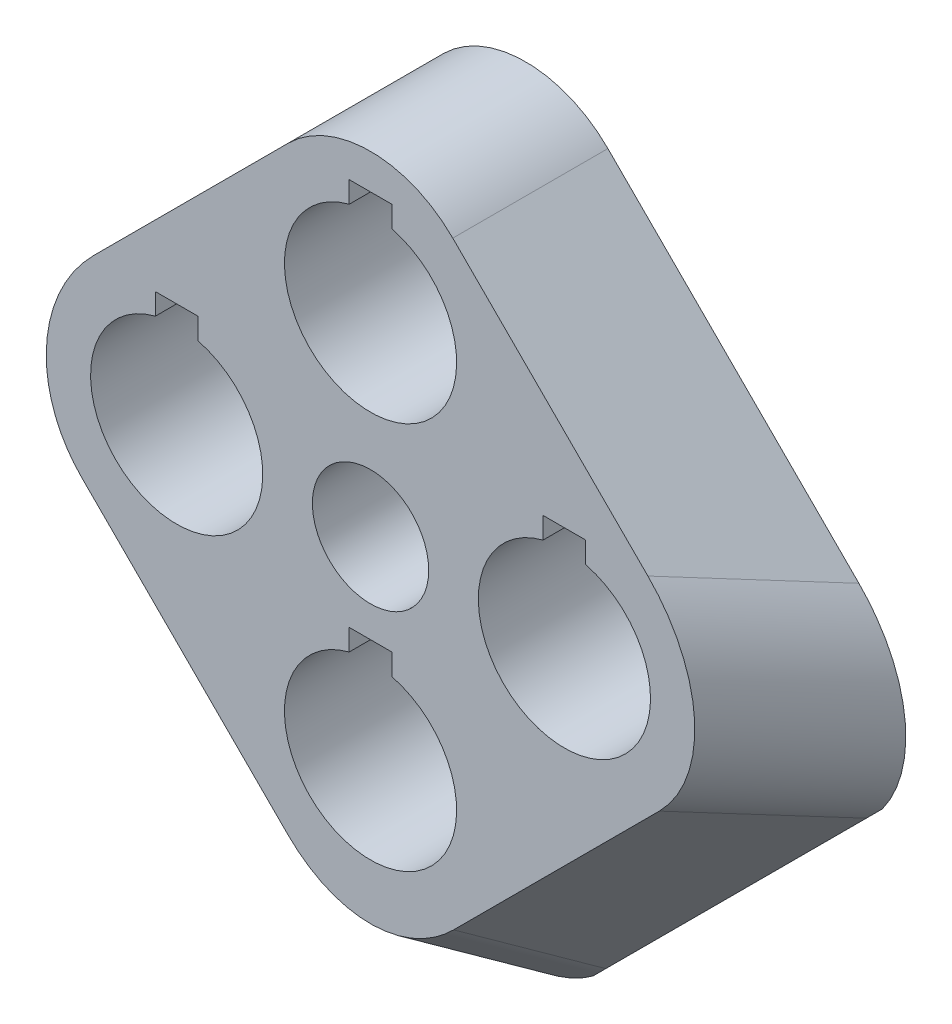
from build123d import *

# Parameters (mm, degrees)
SKETCH1_R           = 7.5
BOSS_EXTRUDE1_DEPTH = 20
FILLET1_R           = 15
BOSS_EXTRUDE2_DEPTH = 20
CHAMFER1_SIZE       = 10
CHAMFER1_SIZE2      = 19.626105055
FILLET2_R           = 17


with BuildPart() as part:
    # Sketch1 → Boss-Extrude1 (new body)
    with BuildSketch(Plane.XY):
        Polygon((0, -24.255339059), (49.255339059, 25), (0, 74.255339059), (-49.255339059, 25), align=None)
        with Locations((0, 25)):
            Circle(SKETCH1_R, mode=Mode.SUBTRACT)
        with BuildLine():
            Line((-2.75, 13.503952762), (2.75, 13.503952762))
            Line((2.75, 13.503952762), (2.75, 10.753952762))
            ThreePointArc((2.75, 10.753952762), (0, -11.1), (-2.75, 10.753952762))
            Line((-2.75, 10.753952762), (-2.75, 13.503952762))
        make_face(mode=Mode.SUBTRACT)
        with BuildLine():
            Line((-2.75, 63.503952762), (2.75, 63.503952762))
            Line((2.75, 63.503952762), (2.75, 60.753952762))
            ThreePointArc((2.75, 60.753952762), (0, 38.9), (-2.75, 60.753952762))
            Line((-2.75, 60.753952762), (-2.75, 63.503952762))
        make_face(mode=Mode.SUBTRACT)
        with BuildLine():
            Line((22.25, 38.503952762), (27.75, 38.503952762))
            Line((27.75, 38.503952762), (27.75, 35.753952762))
            ThreePointArc((27.75, 35.753952762), (25, 13.9), (22.25, 35.753952762))
            Line((22.25, 35.753952762), (22.25, 38.503952762))
        make_face(mode=Mode.SUBTRACT)
        with BuildLine():
            Line((-27.75, 38.503952762), (-22.25, 38.503952762))
            Line((-22.25, 38.503952762), (-22.25, 35.753952762))
            ThreePointArc((-22.25, 35.753952762), (-25, 13.9), (-27.75, 35.753952762))
            Line((-27.75, 35.753952762), (-27.75, 38.503952762))
        make_face(mode=Mode.SUBTRACT)
    extrude(amount=BOSS_EXTRUDE1_DEPTH)

    # Fillet1
    fillet1_edges = [part.edges().sort_by_distance(p)[0] for p in [
        (49.255339059, 25, 10),
        (0, -24.255339059, 10),
        (-49.255339059, 25, 10),
        (0, 74.255339059, 10),
    ]]
    fillet(fillet1_edges, radius=FILLET1_R)

    # Sketch5 → Boss-Extrude2 (add)
    with BuildSketch(Plane(origin=(0, 0, 0), x_dir=(-1, 0, 0), z_dir=(0, 0, -1))):
        Polygon((38.648737342, 35.606601718), (56.326406871, 17.928932188), (0, -38.397474683), (-56.326406871, 17.928932188), (-38.648737342, 35.606601718), (-38.648737342, 14.393398282), (-10.606601718, -13.648737342), (10.606601718, -13.648737342), (38.648737342, 14.393398282), align=None)
    extrude(amount=-BOSS_EXTRUDE2_DEPTH)

    # Chamfer1
    chamfer1_edges = [part.edges().sort_by_distance(p)[0] for p in [
        (-28.163203436, -10.234271247, 20),
        (28.163203436, -10.234271247, 20),
    ]]
    chamfer1_side = [part.faces().sort_by_distance(p)[0] for p in [
        (0, 14.439859593, 20),
    ]]
    chamfer(chamfer1_edges, length=CHAMFER1_SIZE, length2=CHAMFER1_SIZE2, reference=chamfer1_side[0])

    # Fillet2
    # the kernel refuses this fillet: 17 mm, written as the material it takes off along each edge
    with BuildSketch(Plane(origin=(0, -4.097424311, 47.974654117), x_dir=(-0.776565314012209, 0.5111563778483158, -0.3683279387422424), z_dir=(-2.7797289092988672e-15, -0.5846134144132094, -0.8113119965143676))) as fillet2_piece_1:
        with BuildLine():
            CenterArc((FILLET2_R * 0.811311996514, FILLET2_R), FILLET2_R, 191.89433134, 78.10566866)
            Line((-FILLET2_R * 0.167217384978, FILLET2_R * 0.793892626146), (0, 0))
            Line((0, 0), (FILLET2_R * 0.811311996514, 0))
        make_face()
    extrude(amount=93.152096374, mode=Mode.SUBTRACT)
    with BuildSketch(Plane(origin=(35.611999219, 38.643339841, 57.867777278), x_dir=(-0.7071067811865526, -0.7071067811865426, -3.622643282177079e-15), z_dir=(0.3210197609601017, -0.3210197609601017, -0.8910065241883689)), Plane(origin=(-35.611999219, 38.643339841, 57.867777278), x_dir=(0.630036755335051, 0.6300367553350514, -0.45399049973954475), z_dir=(-0.3210197609601016, -0.3210197609601017, -0.8910065241883689))) as fillet2_piece_2:
        with BuildLine():
            CenterArc((FILLET2_R, FILLET2_R), FILLET2_R, 180, 90)
            Line((0, FILLET2_R), (0, 0))
            Line((0, 0), (FILLET2_R, 0))
        make_face()
    extrude(amount=107.026892646, mode=Mode.SUBTRACT)


solid = part.part
